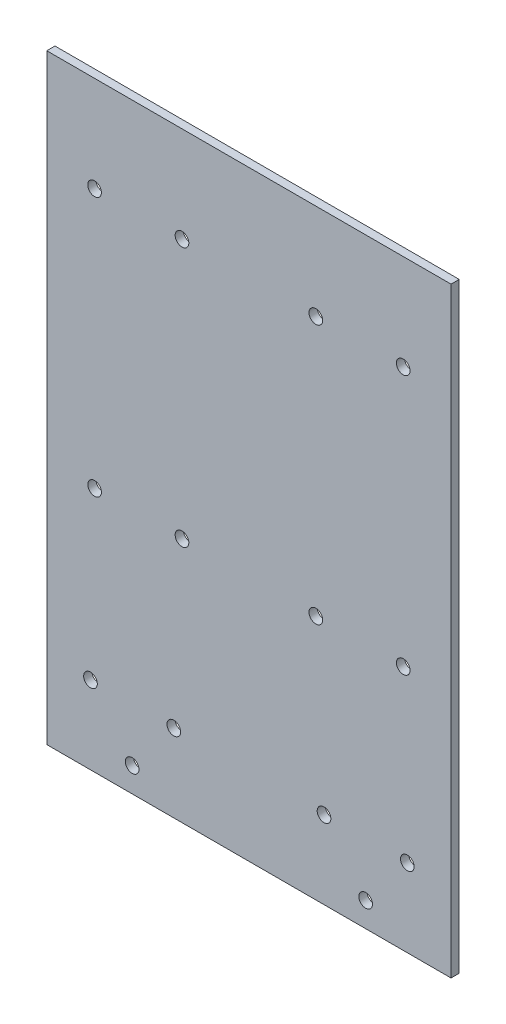
from build123d import *

# Parameters (mm, degrees)
SKETCH_1_W          = 148
SKETCH_1_H          = 220
SKETCH_1_R          = 2.5
EXTRUDE_1_DEPTH     = 3
SKETCH_2_R          = 2.5
CUT_EXTRUDE_1_DEPTH = 3


with BuildPart() as part:
    # 草图1 → 凸台-拉伸1 (new body)
    with BuildSketch(Plane.XY):
        Rectangle(SKETCH_1_W, SKETCH_1_H)
        with Locations((-58, -81.5)):
            Circle(SKETCH_1_R, mode=Mode.SUBTRACT)
        with Locations((-27.5, -81.5)):
            Circle(SKETCH_1_R, mode=Mode.SUBTRACT)
        with Locations((-42.75, -101)):
            Circle(SKETCH_1_R, mode=Mode.SUBTRACT)
        with Locations((42.75, -101)):
            Circle(SKETCH_1_R, mode=Mode.SUBTRACT)
        with Locations((58, -81.5)):
            Circle(SKETCH_1_R, mode=Mode.SUBTRACT)
        with Locations((27.5, -81.5)):
            Circle(SKETCH_1_R, mode=Mode.SUBTRACT)
    extrude(amount=EXTRUDE_1_DEPTH)

    # 草图2 → 切除-拉伸1 (cut)
    with BuildSketch(Plane.XY.offset(3)):
        with Locations((-56.5, -20)):
            Circle(SKETCH_2_R)
        with Locations((-24.5, -20)):
            Circle(SKETCH_2_R)
        with Locations((-56.5, 75)):
            Circle(SKETCH_2_R)
        with Locations((-24.5, 75)):
            Circle(SKETCH_2_R)
        with Locations((-56.5, 170)):
            Circle(SKETCH_2_R)
        with Locations((-24.5, 170)):
            Circle(SKETCH_2_R)
        with Locations((24.5, 170)):
            Circle(SKETCH_2_R)
        with Locations((56.5, 170)):
            Circle(SKETCH_2_R)
        with Locations((24.5, 75)):
            Circle(SKETCH_2_R)
        with Locations((56.5, 75)):
            Circle(SKETCH_2_R)
        with Locations((24.5, -20)):
            Circle(SKETCH_2_R)
        with Locations((56.5, -20)):
            Circle(SKETCH_2_R)
    extrude(amount=-CUT_EXTRUDE_1_DEPTH, mode=Mode.SUBTRACT)


solid = part.part
